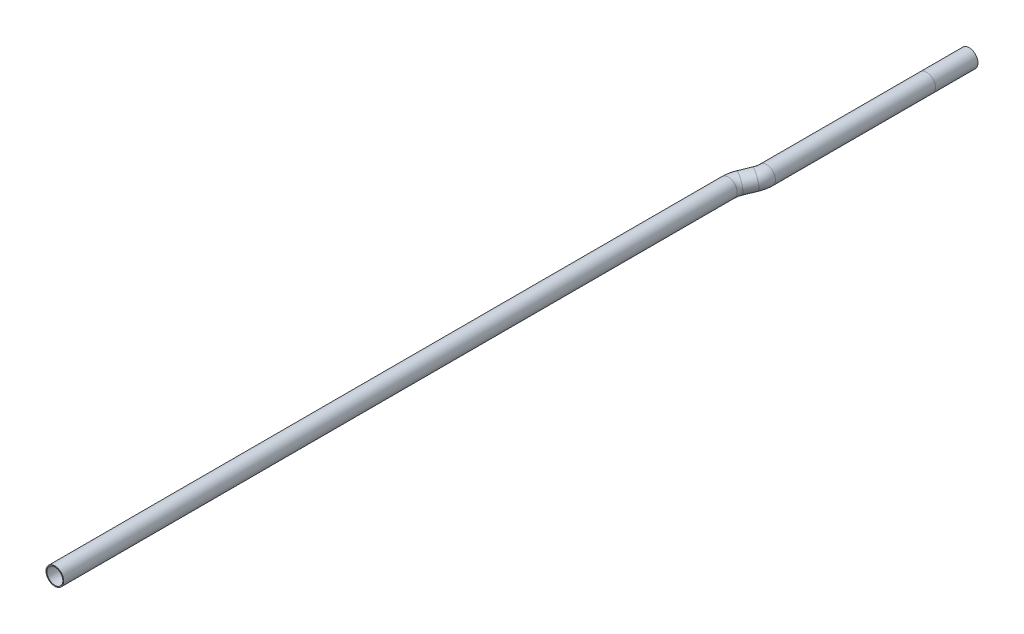
from build123d import *

# Parameters (mm, degrees)
SKETCH1_R   = 3.175
SKETCH1_R_2 = 2.8575


with BuildPart() as part:
    # Sweep1: sweep along a path in Sketch2
    with BuildLine(Plane(origin=(0, 0, 0), x_dir=(0, 0, 1), z_dir=(-0.1950903220161292, 0.9807852804032303, 0))) as sweep1_path:
        Line((-12.7, 3.81), (0, 3.81))
        Line((0, 3.81), (2.54, 3.81))
        Line((2.54, 3.81), (59.847931679, 3.81))
        ThreePointArc((59.847931679, 3.81), (61.491432616, 3.593628997), (63.022931679, 2.959261314))
        Line((63.022931679, 2.959261314), (66.675, 0.850738686))
        ThreePointArc((66.675, 0.850738686), (68.206499064, 0.216371003), (69.85, 0))
        Line((69.85, 0), (311.15, 0))
    # Sketch1 → Sweep1 (sweep)
    with BuildSketch(Plane.XY):
        with Locations((3.736791918, 0.743294127)):
            Circle(SKETCH1_R)
        with Locations((3.736791918, 0.743294127)):
            Circle(SKETCH1_R_2, mode=Mode.SUBTRACT)
    sweep(path=sweep1_path.line)


solid = part.part
